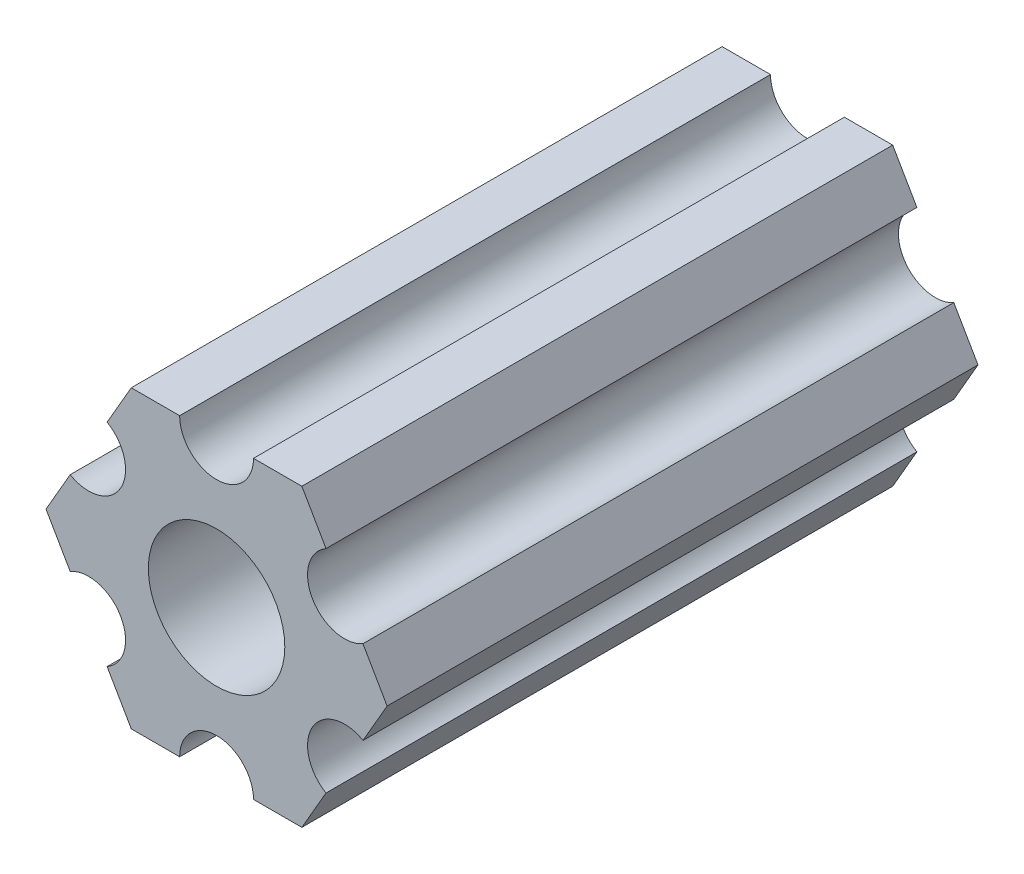
from build123d import *

# Parameters (mm, degrees)
SKETCH1_R           = 2.9337
BOSS_EXTRUDE1_DEPTH = 25.4


with BuildPart() as part:
    # Sketch1 → Boss-Extrude1 (new body)
    with BuildSketch(Plane(origin=(0, 0, 0), x_dir=(-1, 0, 0), z_dir=(0, 0, -1))):
        with BuildLine():
            Line((-4.70551159, -4.549815043), (-3.666174521, -6.349999904))
            Line((-3.666174521, -6.349999904), (-1.587500385, -6.349999904))
            ThreePointArc((-1.587500385, -6.349999904), (-3.85e-07, -4.762499904), (1.587499615, -6.349999904))
            Line((1.587499615, -6.349999904), (3.666173825, -6.349999904))
            Line((3.666173825, -6.349999904), (4.705510942, -4.54981524))
            ThreePointArc((4.705510942, -4.54981524), (4.124445629, -2.381249907), (6.293010962, -1.800184594))
            Line((6.293010962, -1.800184594), (7.332348079, 7e-08))
            Line((7.332348079, 7e-08), (6.293011217, 1.800184685))
            ThreePointArc((6.293011217, 1.800184685), (4.124445939, 2.381250203), (4.705511457, 4.549815481))
            Line((4.705511457, 4.549815481), (3.666174521, 6.350000222))
            Line((3.666174521, 6.350000222), (1.587500385, 6.350000222))
            ThreePointArc((1.587500385, 6.350000222), (3.85e-07, 4.762500222), (-1.587499615, 6.350000222))
            Line((-1.587499615, 6.350000222), (-3.666173825, 6.350000222))
            Line((-3.666173825, 6.350000222), (-4.705511038, 4.549815614))
            ThreePointArc((-4.705511038, 4.549815614), (-4.124445841, 2.38125025), (-6.293011205, 1.800185053))
            Line((-6.293011205, 1.800185053), (-7.332348419, 4.44e-07))
            Line((-7.332348419, 4.44e-07), (-6.293011423, -1.80018429))
            ThreePointArc((-6.293011423, -1.80018429), (-4.12444613, -2.38124975), (-4.70551159, -4.549815043))
        make_face()
        Circle(SKETCH1_R, mode=Mode.SUBTRACT)
    extrude(amount=BOSS_EXTRUDE1_DEPTH)


solid = part.part
